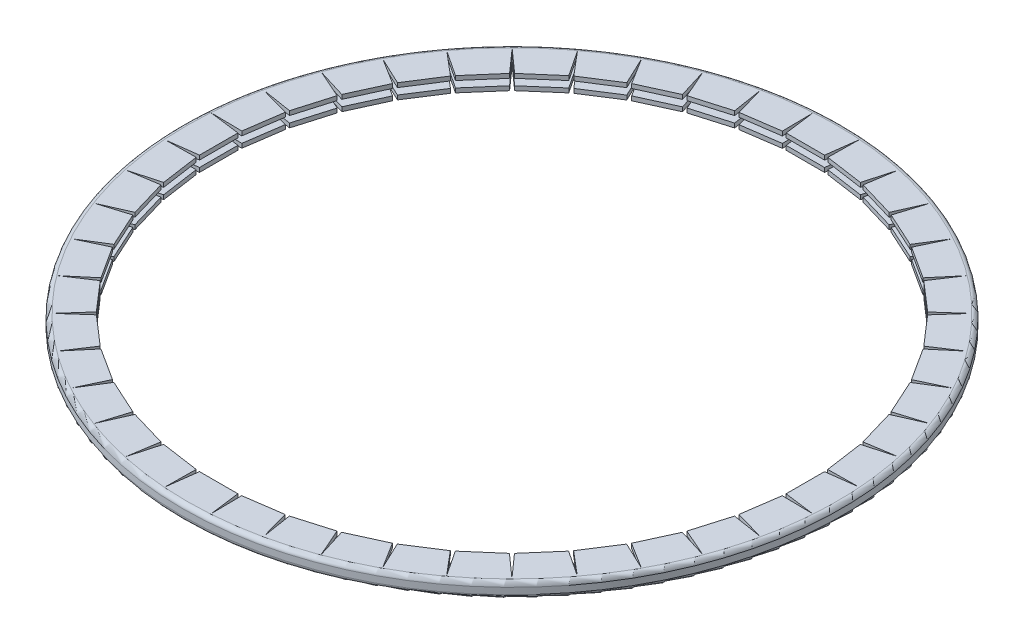
from build123d import *
from build123d.topology import SkipClean

# Parameters (mm, degrees)
SKETCH1_R           = 244.475
SKETCH1_R_2         = 241.3
BOSS_EXTRUDE1_DEPTH = 11.1125
BOSS_EXTRUDE2_DEPTH = 11.1125
CIRPATTERN1_COUNT   = 44
CIRPATTERN1_ANGLE   = 351.8
SKETCH4_W           = 50.8
SKETCH4_H           = 4.7625
FILLET1_R           = 3.175


with BuildPart() as part:
    # Sketch1 → Boss-Extrude1 (new body)
    with BuildSketch(Plane(origin=(0, 0, 0), x_dir=(1, 0, 0), z_dir=(0, 1, 0))):
        with Locations(Location((0, 0, 0), (0, 0, 270))):
            Circle(SKETCH1_R)
        with Locations(Location((0, 0, 0), (0, 0, 270))):
            Circle(SKETCH1_R_2, mode=Mode.SUBTRACT)
    extrude(amount=BOSS_EXTRUDE1_DEPTH)

    # Sketch3 → Boss-Extrude2 (add)
    with BuildSketch(Plane(origin=(0, 0, 0), x_dir=(1, 0, 0), z_dir=(0, 1, 0))):
        with BuildLine():
            Line((-240.682871822, 17.2466), (-217.568871822, 14.224))
            Line((-217.568871822, 14.224), (-217.568871822, -14.224))
            Line((-217.568871822, -14.224), (-240.682871822, -17.2466))
            ThreePointArc((-240.682871822, -17.2466), (-241.3, 0), (-240.682871822, 17.2466))
        make_face()
    boss_extrude2 = extrude(amount=BOSS_EXTRUDE2_DEPTH)

    # CirPattern1: Boss-Extrude2 ×44 about axis
    cirpattern1_axis = Axis((0, 0, 0), (0, 1, 0))
    for i in range(1, CIRPATTERN1_COUNT):
        add(boss_extrude2.rotate(cirpattern1_axis, i * CIRPATTERN1_ANGLE / (CIRPATTERN1_COUNT - 1)))

    # Sketch4 → Cut-Revolve1 (revolve, cut)
    with SkipClean():  # the faces are left unmerged after this step: merging them gives an invalid solid
        with BuildSketch(Plane(origin=(0, 0, 0), x_dir=(0, 0, -1), z_dir=(1, 0, 0)), mode=Mode.PRIVATE) as cut_revolve1_sk:
            with Locations((215.9, 5.55625)):
                Rectangle(SKETCH4_W, SKETCH4_H)
        revolve(cut_revolve1_sk.sketch.rotate(Axis((0, 0, 0), (0, 1, 0)), 85.898635154), axis=Axis((0, 0, 0), (0, 1, 0)), mode=Mode.SUBTRACT)

    # Fillet1
    fillet1_edges = [part.edges().sort_by_distance(p)[0] for p in [
        (0, 0, -244.475),
        (0, 11.1125, -244.475),
    ]]
    fillet(fillet1_edges, radius=FILLET1_R - 0.0001)  # a hair under: the kernel refuses the full size


solid = part.part
